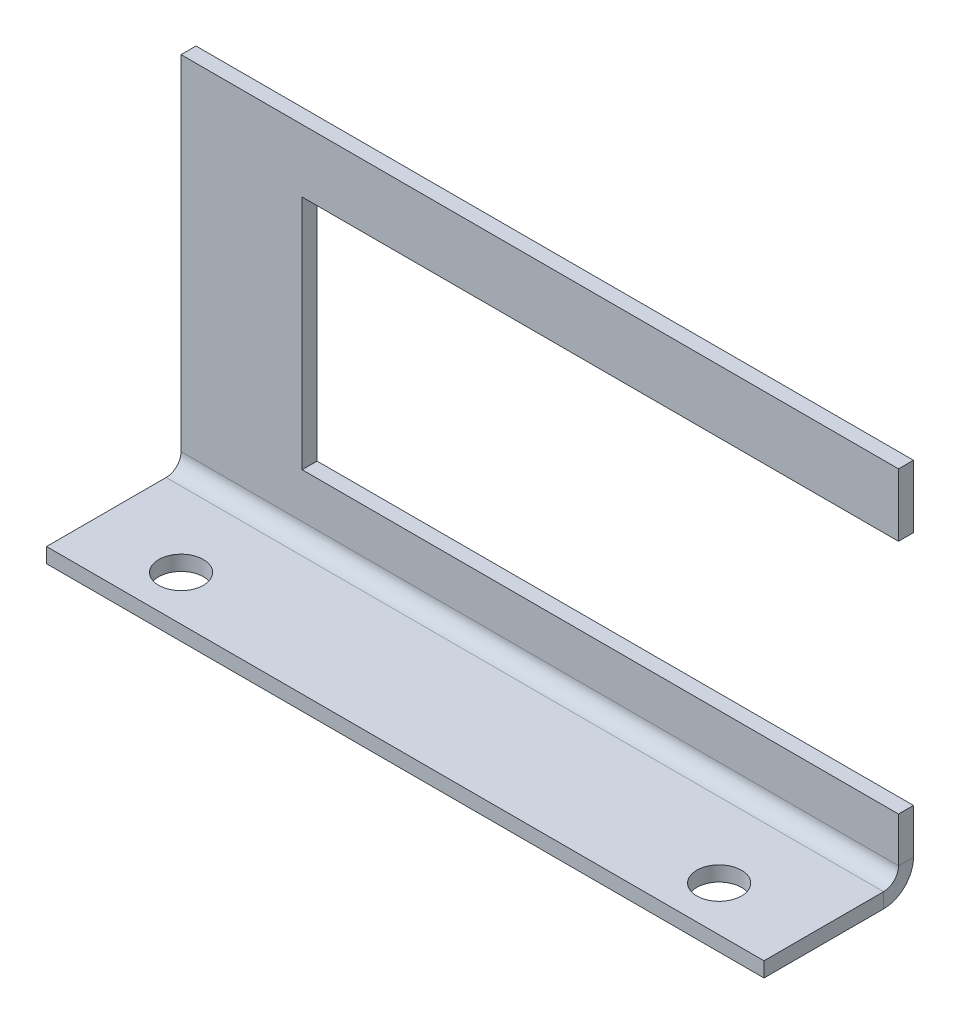
from build123d import *

# Parameters (mm, degrees)
BOSS_EXTRUDE1_DEPTH    = 60.96
CONVERT_SOLID1_DEPTH   = 60.96
CONVERT_SOLID1_2_DEPTH = 60.96
SKETCH6_W              = 40.386
SKETCH6_H              = 20.066
CUT_EXTRUDE1_DEPTH     = 70.67660296
SKETCH8_R              = 1.89865
CUT_EXTRUDE2_DEPTH     = 70.328507845
SKETCH11_W             = 18.1335173
SKETCH11_H             = 20.066
CUT_EXTRUDE5_DEPTH     = 70.67660296


# Read off the part's stored shape, not the designer's step: Convert-Solid1
with BuildPart() as part:
    # Sketch1 → Boss-Extrude1 (new body)
    with BuildSketch(Plane(origin=(0, 0, 0), x_dir=(0, 0, -1), z_dir=(1, 0, 0))):
        Polygon((0, 0), (12.7, 0), (12.7, 31.75), (11.43, 31.75), (11.43, 1.27), (0, 1.27), align=None)
    extrude(amount=BOSS_EXTRUDE1_DEPTH)

    # Convert-Solid1 outline → Convert-Solid1 (cut)
    with BuildSketch(Plane.YZ):
        with BuildLine():
            ThreePointArc((2.54, -12.7), (0.743948776, -11.956051224), (0, -10.16))
            Line((0, -10.16), (0, -12.7))
            Line((0, -12.7), (2.54, -12.7))
        make_face()
    extrude(amount=CONVERT_SOLID1_DEPTH, mode=Mode.SUBTRACT)

    # Convert-Solid1 2 outline → Convert-Solid1 2 (add)
    with BuildSketch(Plane.YZ):
        with BuildLine():
            ThreePointArc((2.54, -11.43), (1.641974388, -11.058025612), (1.27, -10.16))
            Line((1.27, -10.16), (1.27, -11.43))
            Line((1.27, -11.43), (2.54, -11.43))
        make_face()
    extrude(amount=CONVERT_SOLID1_2_DEPTH)

    # Sketch6 → Cut-Extrude1 (cut, through all)
    with BuildSketch(Plane.XY.offset(-11.43)):
        with Locations((30.48, 16.383)):
            Rectangle(SKETCH6_W, SKETCH6_H)
    extrude(amount=-CUT_EXTRUDE1_DEPTH, mode=Mode.SUBTRACT)

    # Sketch8 → Cut-Extrude2 (cut, through all)
    with BuildSketch(Plane(origin=(0, 1.27, 0), x_dir=(1, 0, 0), z_dir=(0, 1, 0))):
        with Locations(Location((7.62, 3.81, 0), (0, 0, 270))):
            Circle(SKETCH8_R)
        with Locations(Location((53.34, 3.81, 0), (0, 0, 270))):
            Circle(SKETCH8_R)
    extrude(amount=-CUT_EXTRUDE2_DEPTH, mode=Mode.SUBTRACT)

    # Sketch11 → Cut-Extrude5 (cut, through all)
    with BuildSketch(Plane.XY.offset(-11.43)):
        with Locations((59.73975865, 16.383)):
            Rectangle(SKETCH11_W, SKETCH11_H)
    extrude(amount=-CUT_EXTRUDE5_DEPTH, mode=Mode.SUBTRACT)


solid = part.part
